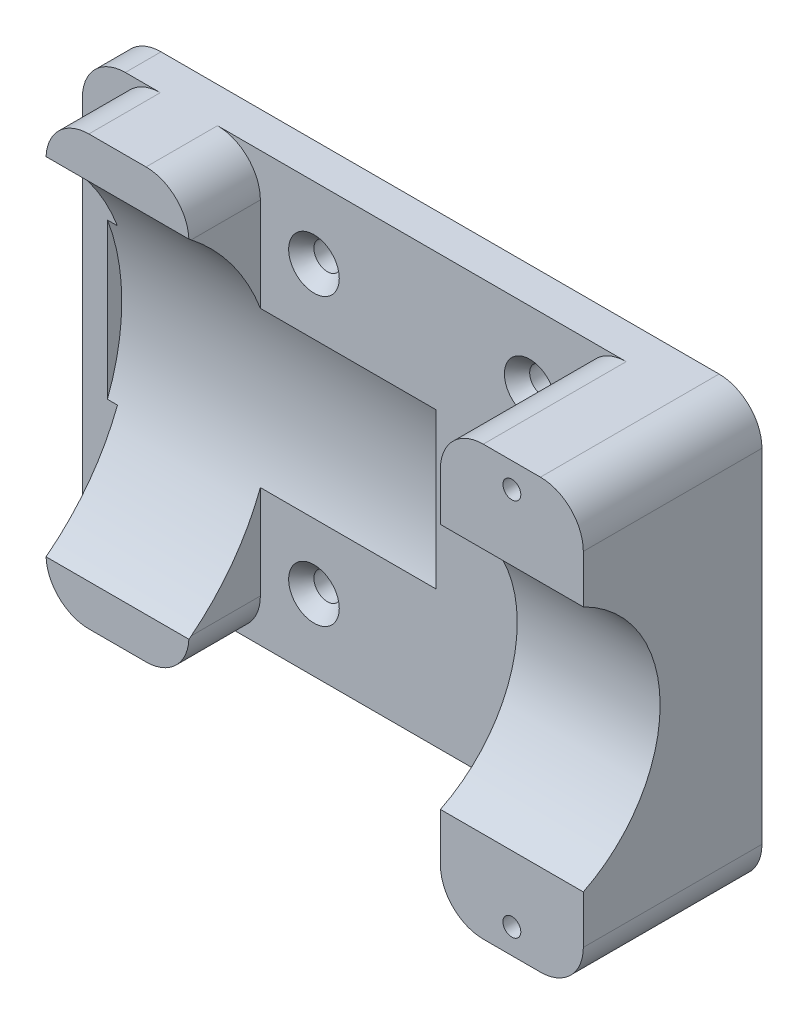
from build123d import *

# Parameters (mm, degrees)
BASE_SKETCH_W                   = 90
BASE_SKETCH_H                   = 60
BASE_EXTRUDE_DEPTH              = 5
CRADLE_SKETCH_W                 = 20
CRADLE_SKETCH_H                 = 60
CRADLE_EXTRUDE_DEPTH            = 25
NO_6_MOUNTING_HOLES_D           = 3.7973
NO_6_MOUNTING_HOLES_CSINK_D     = 7.0866
NO_6_MOUNTING_HOLES_CSINK_ANGLE = 82
MOVE_START                      = 15
MOVE_FACE_OUTLINE_W             = 20
MOVE_FACE_OUTLINE_H             = 60
MOVE_FACE_DEPTH                 = 10
CLAMP_THREADED_HOLE_D           = 2.5
CRADLE_FILLETS_R                = 6
BASE_FILLETS_R                  = 6


# Read off the part's stored shape, not the designer's step: Move Face
with BuildPart() as part:
    # Base Sketch → Base Extrude (new body)
    with BuildSketch(Plane.XY):
        with Locations((-2.5, 0)):
            Rectangle(BASE_SKETCH_W, BASE_SKETCH_H)
    extrude(amount=BASE_EXTRUDE_DEPTH)

    # Cradle Sketch → Cradle Extrude (add)
    with BuildSketch(Plane.XY):
        with Locations((-32.6, 0)):
            Rectangle(CRADLE_SKETCH_W, CRADLE_SKETCH_H)
        with Locations((32.6, 0)):
            Rectangle(CRADLE_SKETCH_W, CRADLE_SKETCH_H)
    extrude(amount=CRADLE_EXTRUDE_DEPTH)

    # No. 6 Mounting Holes (through all)
    with Locations(Plane.XY.offset(5)):
        with Locations((-15.1, 20), (15.1, 20), (-15.1, -20), (15.1, -20)):
            CounterSinkHole(NO_6_MOUNTING_HOLES_D / 2, NO_6_MOUNTING_HOLES_CSINK_D / 2, counter_sink_angle=NO_6_MOUNTING_HOLES_CSINK_ANGLE)

    # Pump and Motor Revolve Cut Sketch → Pump and Motor Revolve Cut (revolve, cut)
    with BuildSketch(Plane(origin=(0, 0, 0), x_dir=(1, 0, 0), z_dir=(0, 1, 0))):
        Polygon((-44, -33.5), (-44, -3), (2, -3), (2, -14.25), (66, -14.25), (66, -33.5), align=None)
    revolve(axis=Axis((66, 0, 33.5), (-1, 0, 0)), mode=Mode.SUBTRACT)

    # Move Face outline → Move Face (cut)
    with BuildSketch(Plane.XY.offset(MOVE_START)):
        with Locations((-32.6, 0)):
            Rectangle(MOVE_FACE_OUTLINE_W, MOVE_FACE_OUTLINE_H)
    extrude(amount=MOVE_FACE_DEPTH, mode=Mode.SUBTRACT)

    # Clamp Threaded Hole (through all)
    with Locations(Plane.XY.offset(25)):
        with Locations((32.6, -26.5)):
            clamp_threaded_hole = Hole(CLAMP_THREADED_HOLE_D / 2)

    # Threaded Hole Mirror: Clamp Threaded Hole across plane
    add(clamp_threaded_hole.mirror(Plane.ZX), mode=Mode.SUBTRACT)

    # Cradle Fillets
    cradle_fillets_edges = [part.edges().sort_by_distance(p)[0] for p in [
        (-42.6, 30, 10),
        (42.6, 30, 12.5),
        (42.6, -30, 12.5),
        (-42.6, -30, 10),
        (22.6, 30, 15),
        (22.6, -30, 15),
        (-22.6, 30, 10),
        (-22.6, -30, 10),
    ]]
    fillet(cradle_fillets_edges, radius=CRADLE_FILLETS_R)

    # Base Fillets
    base_fillets_edges = [part.edges().sort_by_distance(p)[0] for p in [
        (-47.5, -30, 2.5),
        (-47.5, 30, 2.5),
    ]]
    fillet(base_fillets_edges, radius=BASE_FILLETS_R)


solid = part.part
